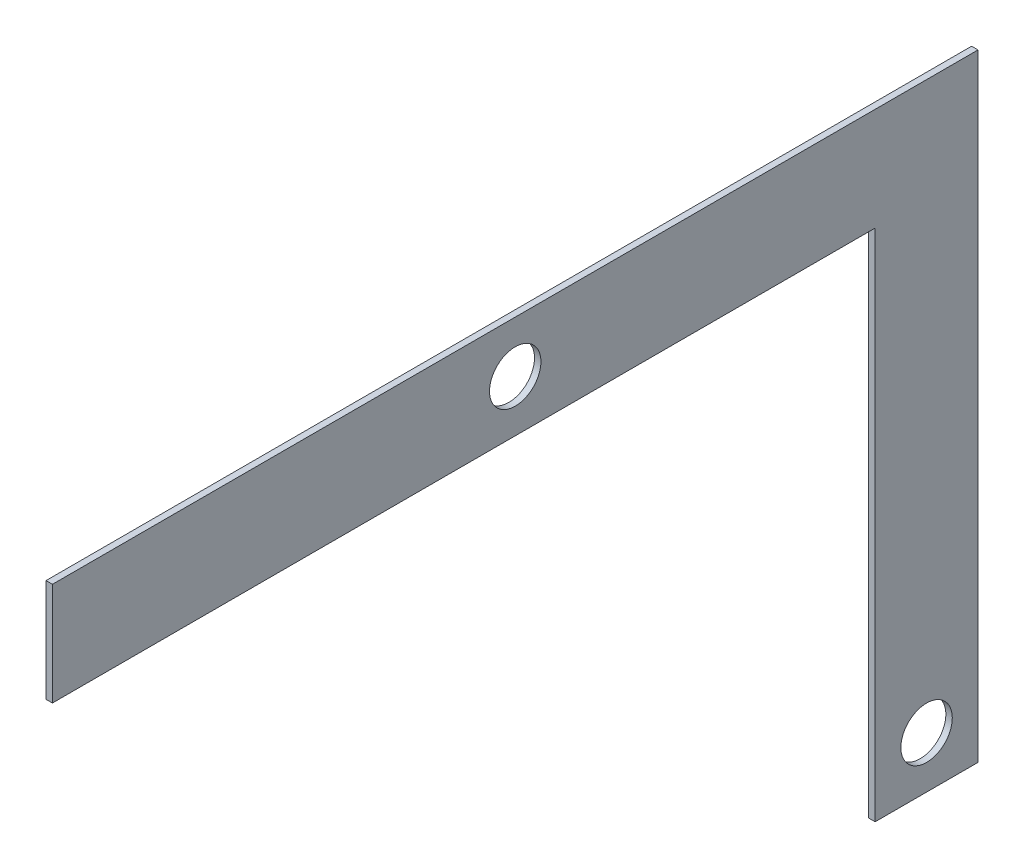
from build123d import *

# Parameters (mm, degrees)
SKETCH1_R           = 12.7
BOSS_EXTRUDE1_DEPTH = 3.175
SKETCH3_R           = 12.7
CUT_EXTRUDE1_DEPTH  = 362.015789994
SKETCH4_W           = 50.8
SKETCH4_H           = 254
CUT_EXTRUDE2_DEPTH  = 362.015789994


with BuildPart() as part:
    # Sketch1 → Boss-Extrude1 (new body)
    with BuildSketch(Plane(origin=(0, 0, 0), x_dir=(0, 0, -1), z_dir=(1, 0, 0))):
        Polygon((-228.6, 25.4), (228.6, 25.4), (228.6, -279.4), (177.8, -279.4), (177.8, -25.4), (-177.8, -25.4), (-177.8, -279.4), (-228.6, -279.4), align=None)
        Circle(SKETCH1_R, mode=Mode.SUBTRACT)
    extrude(amount=BOSS_EXTRUDE1_DEPTH)

    # Sketch3 → Cut-Extrude1 (cut, through all)
    with BuildSketch(Plane(origin=(3.175, 0, 0), x_dir=(0, 0, -1), z_dir=(1, 0, 0))):
        with Locations((-203.2, -254)):
            Circle(SKETCH3_R)
        with Locations((203.2, -254)):
            Circle(SKETCH3_R)
    extrude(amount=-CUT_EXTRUDE1_DEPTH, mode=Mode.SUBTRACT)

    # Sketch4 → Cut-Extrude2 (cut, through all)
    with BuildSketch(Plane(origin=(3.175, 0, 0), x_dir=(0, 0, -1), z_dir=(1, 0, 0))):
        with Locations((-203.2, -152.4)):
            Rectangle(SKETCH4_W, SKETCH4_H)
    extrude(amount=-CUT_EXTRUDE2_DEPTH, mode=Mode.SUBTRACT)


solid = part.part
